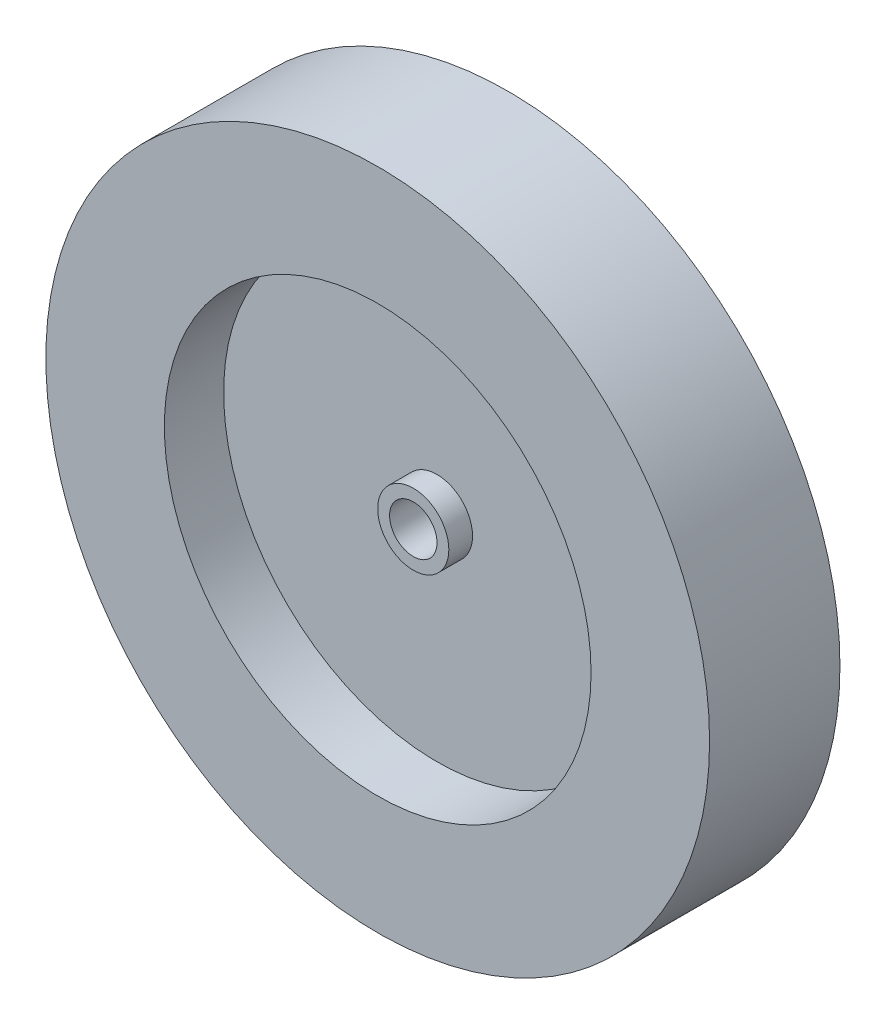
from build123d import *

# Parameters (mm, degrees)
SKETCH1_R               = 88.9
SKETCH1_R_2             = 69.85
BOSS_EXTRUDE1_DEPTH     = 17.4625
SKETCH2_R               = 69.85
BOSS_EXTRUDE2_DEPTH     = 1.5875
SKETCH3_R               = 69.85
SKETCH3_R_2             = 57.15
BOSS_EXTRUDE3_DEPTH     = 17.4625
SKETCH4_R               = 9.525
BOSS_EXTRUDE4_DEPTH     = 7.9375
BOSS_EXTRUDE5_START     = -25.4
SKETCH5_R               = 9.525
BOSS_EXTRUDE5_DEPTH     = 25.4
CUT_EXTRUDE1_DEPTH      = 129.263712717
CUT_EXTRUDE1_DEPTH_BACK = 129.263712717
SKETCH6_R               = 6.35


with BuildPart() as part:
    # Sketch1 → Boss-Extrude1 (new, symmetric)
    with BuildSketch(Plane.XY):
        Circle(SKETCH1_R)
        Circle(SKETCH1_R_2, mode=Mode.SUBTRACT)
    extrude(amount=BOSS_EXTRUDE1_DEPTH, both=True)

    # Sketch2 → Boss-Extrude2 (add, symmetric)
    with BuildSketch(Plane.XY):
        Circle(SKETCH2_R)
    extrude(amount=BOSS_EXTRUDE2_DEPTH, both=True)



with BuildPart() as body_2:
    # Sketch3 → Boss-Extrude3 (new, symmetric)
    with BuildSketch(Plane.XY):
        Circle(SKETCH3_R)
        Circle(SKETCH3_R_2, mode=Mode.SUBTRACT)
    extrude(amount=BOSS_EXTRUDE3_DEPTH, both=True)


with BuildPart() as part_1:
    add(part.part)

    add(body_2.part)  # Boss-Extrude4 merges body 2
    # Sketch4 → Boss-Extrude4 (add)
    with BuildSketch(Plane.XY):
        Circle(SKETCH4_R)
    extrude(amount=BOSS_EXTRUDE4_DEPTH)

    # Sketch5 → Boss-Extrude5 (add)
    with BuildSketch(Plane.XY.offset(BOSS_EXTRUDE5_START)):
        Circle(SKETCH5_R)
    extrude(amount=BOSS_EXTRUDE5_DEPTH)

    # Sketch6 → Cut-Extrude1 (cut, two sides: drawn at the far end of the back side and taken through both)
    with BuildSketch(Plane.XY.offset(-CUT_EXTRUDE1_DEPTH_BACK)):
        Circle(SKETCH6_R)
    extrude(amount=CUT_EXTRUDE1_DEPTH + CUT_EXTRUDE1_DEPTH_BACK, mode=Mode.SUBTRACT)


solid = part_1.part
